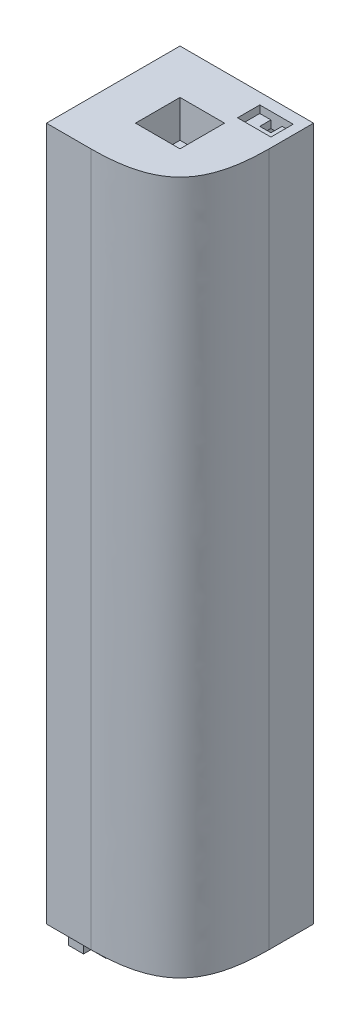
from build123d import *

# Parameters (mm, degrees)
SKETCH1_W           = 36
SKETCH1_H           = 36
BOSS_EXTRUDE1_DEPTH = 186.9
FILLET1_SIZE        = 24
SKETCH2_W           = 14.28
SKETCH2_H           = 23.5
CUT_EXTRUDE1_DEPTH  = 27
SKETCH3_W           = 11.78
SKETCH3_H           = 21
CUT_EXTRUDE2_DEPTH  = 8
SKETCH4_R           = 2
CUT_EXTRUDE3_DEPTH  = 5
BOSS_EXTRUDE2_DEPTH = 4
SKETCH6_W           = 6
SKETCH6_H           = 4
CUT_EXTRUDE4_DEPTH  = 9
SKETCH7_W           = 3
SKETCH7_H           = 3
SKETCH7_W_2         = 12
SKETCH7_H_2         = 12
CUT_EXTRUDE5_DEPTH  = 10
SKETCH8_W           = 9
SKETCH8_H           = 6
CUT_EXTRUDE6_DEPTH  = 2


with BuildPart() as part:
    # Sketch1 → Boss-Extrude1 (new body)
    with BuildSketch(Plane(origin=(0, 0, 0), x_dir=(1, 0, 0), z_dir=(0, 1, 0))):
        with Locations((18, 18)):
            Rectangle(SKETCH1_W, SKETCH1_H)
    extrude(amount=BOSS_EXTRUDE1_DEPTH)

    # Fillet1
    # a fillet whose section is not a circle: 24 mm, written as the material it takes off along each edge
    with BuildSketch(Plane(origin=(36, -60, 0), x_dir=(-1, 0, 0), z_dir=(0, 1, 0))) as fillet1_piece_1:
        with BuildLine():
            Bezier((FILLET1_SIZE, 0), (0, 0), (0, -FILLET1_SIZE), weights=[1, 1.222222222, 1])
            Line((0, -FILLET1_SIZE), (0, 0))
            Line((0, 0), (FILLET1_SIZE, 0))
        make_face()
    extrude(amount=306.9, mode=Mode.SUBTRACT)

    # Sketch2 → Cut-Extrude1 (cut)
    with BuildSketch(Plane.XZ):
        with Locations((7.14, -24.25)):
            Rectangle(SKETCH2_W, SKETCH2_H)
    extrude(amount=-CUT_EXTRUDE1_DEPTH, mode=Mode.SUBTRACT)

    # Sketch3 → Cut-Extrude2 (cut)
    with BuildSketch(Plane.XZ.offset(-27)):
        with Locations((5.89, -25.5)):
            Rectangle(SKETCH3_W, SKETCH3_H)
    extrude(amount=-CUT_EXTRUDE2_DEPTH, mode=Mode.SUBTRACT)

    # Sketch4 → Cut-Extrude3 (cut)
    with BuildSketch(Plane.XZ):
        with Locations(Location((21, -15, 0), (0, 0, 270))):
            Circle(SKETCH4_R)
    extrude(amount=-CUT_EXTRUDE3_DEPTH, mode=Mode.SUBTRACT)

    # Sketch5 → Boss-Extrude2 (add)
    with BuildSketch(Plane.XZ):
        Polygon((18, -28), (22, -28), (22, -24), (28, -24), (28, -28), (32, -28), (32, -32), (18, -32), align=None)
        Polygon((4, -2), (8, -2), (8, -4), (12, -4), (12, -8), (8, -8), (8, -10), (4, -10), align=None)
    extrude(amount=BOSS_EXTRUDE2_DEPTH)

    # Sketch6 → Cut-Extrude4 (cut)
    with BuildSketch(Plane(origin=(0, 0, -36), x_dir=(-1, 0, 0), z_dir=(0, 0, -1))):
        with Locations((-29, 180.9)):
            Rectangle(SKETCH6_W, SKETCH6_H)
        with Locations((-7, 180.9)):
            Rectangle(SKETCH6_W, SKETCH6_H)
        with Locations((-29, 160.9)):
            Rectangle(SKETCH6_W, SKETCH6_H)
    extrude(amount=-CUT_EXTRUDE4_DEPTH, mode=Mode.SUBTRACT)

    # Sketch7 → Cut-Extrude5 (cut)
    with BuildSketch(Plane(origin=(0, 186.9, 0), x_dir=(1, 0, 0), z_dir=(0, 1, 0))):
        with Locations((29, 31.5)):
            Rectangle(SKETCH7_W, SKETCH7_H)
        with Locations((18, 18)):
            Rectangle(SKETCH7_W_2, SKETCH7_H_2)
    extrude(amount=-CUT_EXTRUDE5_DEPTH, mode=Mode.SUBTRACT)

    # Sketch8 → Cut-Extrude6 (cut)
    with BuildSketch(Plane(origin=(0, 186.9, 0), x_dir=(1, 0, 0), z_dir=(0, 1, 0))):
        with Locations((29, 30)):
            Rectangle(SKETCH8_W, SKETCH8_H)
    extrude(amount=-CUT_EXTRUDE6_DEPTH, mode=Mode.SUBTRACT)


solid = part.part
